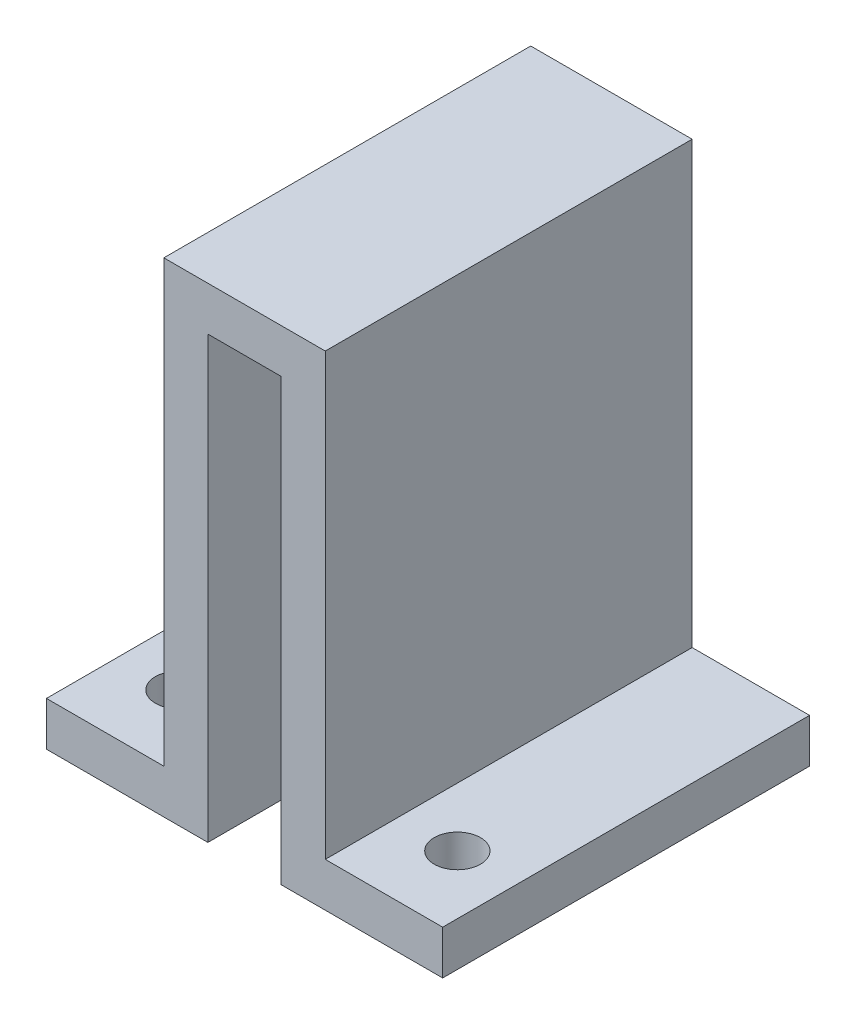
from build123d import *

# Parameters (mm, degrees)
BOSS_EXTRUDE1_DEPTH = 31.75
SKETCH2_R           = 2
CUT_EXTRUDE1_DEPTH  = 56.303359979


with BuildPart() as part:
    # Sketch1 → Boss-Extrude1 (new body)
    with BuildSketch(Plane.XY):
        Polygon((-3.175, 0), (3.175, 0), (3.175, -38.1), (17.145, -38.1), (17.145, -34.29), (6.985, -34.29), (6.985, 3.81), (-6.985, 3.81), (-6.985, -34.29), (-17.145, -34.29), (-17.145, -38.1), (-3.175, -38.1), align=None)
    extrude(amount=BOSS_EXTRUDE1_DEPTH)

    # Sketch2 → Cut-Extrude1 (cut, through all)
    with BuildSketch(Plane.XZ.offset(38.1)):
        with Locations((12.065, 25.4)):
            Circle(SKETCH2_R)
        with Locations((-12.065, 25.4)):
            Circle(SKETCH2_R)
    extrude(amount=-CUT_EXTRUDE1_DEPTH, mode=Mode.SUBTRACT)


solid = part.part
